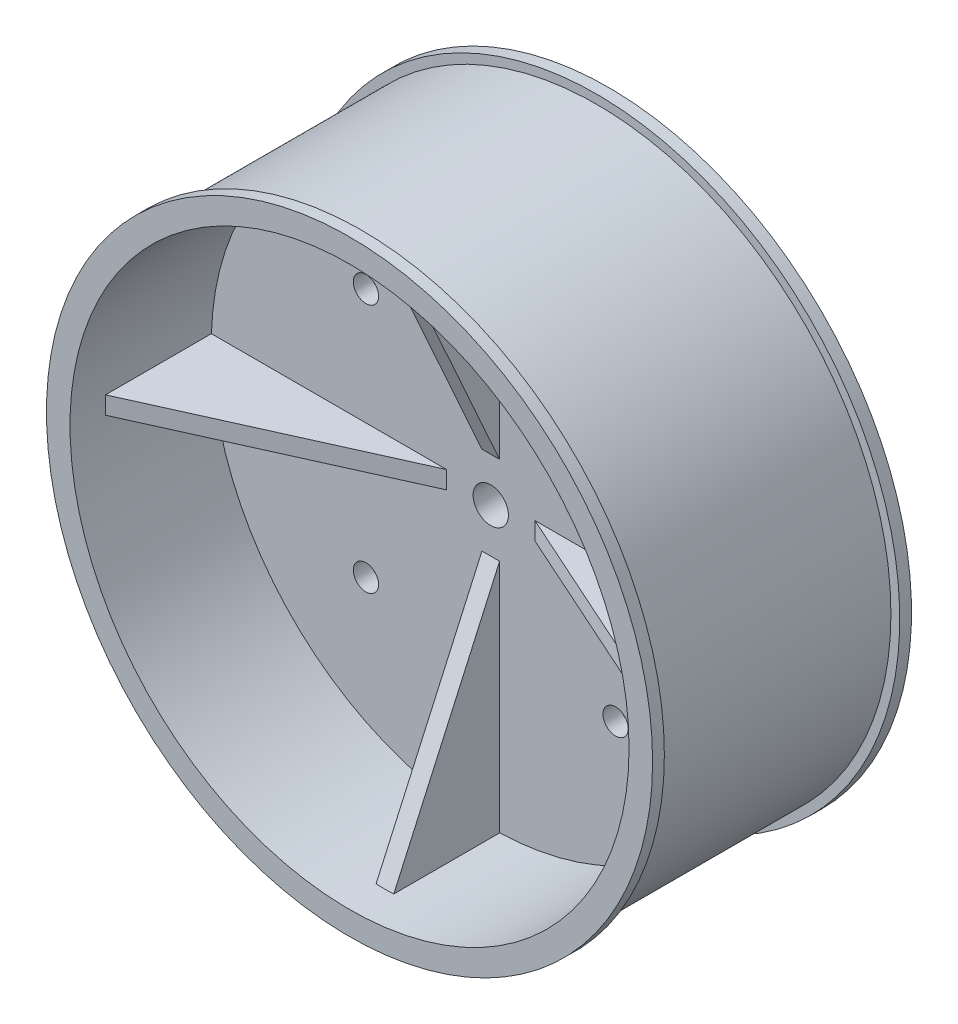
from build123d import *

# Parameters (mm, degrees)
SKETCH1_R               = 50
SKETCH1_R_2             = 47.5
BOSS_EXTRUDE1_DEPTH     = 40
SKETCH2_R               = 51.5
SKETCH2_R_2             = 47.5
BOSS_EXTRUDE2_DEPTH     = 2
BOSS_EXTRUDE3_START     = 2
SKETCH3_R               = 51.5
SKETCH3_R_2             = 47.5
BOSS_EXTRUDE3_DEPTH     = 2
SKETCH4_R               = 47.5
BOSS_EXTRUDE4_DEPTH     = 3
SKETCH5_R               = 8
BOSS_EXTRUDE5_DEPTH     = 25
SKETCH6_R               = 5
BOSS_EXTRUDE6_DEPTH     = 26.25
BOSS_EXTRUDE7_DEPTH     = 1.5
BOSS_EXTRUDE8_DEPTH     = 1.5
BOSS_EXTRUDE9_DEPTH     = 1.5
BOSS_EXTRUDE10_DEPTH    = 1.5
CUT_EXTRUDE1_DEPTH      = 91.222294917
CUT_EXTRUDE1_DEPTH_BACK = 91.222294917
SKETCH12_R              = 3
SKETCH13_R              = 4
CUT_EXTRUDE2_DEPTH      = 20
SKETCH14_R              = 1.5
CUT_EXTRUDE3_DEPTH      = 20
SKETCH15_R              = 2.15
CUT_EXTRUDE4_DEPTH      = 79.48606568


with BuildPart() as part:
    # Sketch1 → Boss-Extrude1 (new body)
    with BuildSketch(Plane.XY):
        Circle(SKETCH1_R)
        Circle(SKETCH1_R_2, mode=Mode.SUBTRACT)
    extrude(amount=BOSS_EXTRUDE1_DEPTH)

    # Sketch2 → Boss-Extrude2 (add)
    with BuildSketch(Plane.XY.offset(40)):
        Circle(SKETCH2_R)
        Circle(SKETCH2_R_2, mode=Mode.SUBTRACT)
    extrude(amount=BOSS_EXTRUDE2_DEPTH)

    # Sketch3 → Boss-Extrude3 (add)
    with BuildSketch(Plane(origin=(0, 0, 0), x_dir=(-1, 0, 0), z_dir=(0, 0, -1)).offset(BOSS_EXTRUDE3_START)):
        Circle(SKETCH3_R)
        Circle(SKETCH3_R_2, mode=Mode.SUBTRACT)
    extrude(amount=-BOSS_EXTRUDE3_DEPTH)

    # Sketch4 → Boss-Extrude4 (add)
    with BuildSketch(Plane(origin=(0, 0, 15), x_dir=(-1, 0, 0), z_dir=(0, 0, -1))):
        Circle(SKETCH4_R)
    extrude(amount=-BOSS_EXTRUDE4_DEPTH)

    # Sketch5 → Boss-Extrude5 (add)
    with BuildSketch(Plane(origin=(0, 0, 15), x_dir=(-1, 0, 0), z_dir=(0, 0, -1))):
        Circle(SKETCH5_R)
    extrude(amount=BOSS_EXTRUDE5_DEPTH)

    # Sketch6 → Boss-Extrude6 (add)
    with BuildSketch(Plane(origin=(0, 0, 15), x_dir=(-1, 0, 0), z_dir=(0, 0, -1))):
        Circle(SKETCH6_R)
    extrude(amount=BOSS_EXTRUDE6_DEPTH)

    # Sketch7 → Boss-Extrude7 (add, symmetric)
    with BuildSketch(Plane(origin=(0, 0, 0), x_dir=(1, 0, 0), z_dir=(0, 1, 0))):
        Polygon((-47.5, -15), (-5, -15), (-47.5, -4), align=None)
        Polygon((47.5, -15), (47.5, -4), (5, -15), align=None)
    extrude(amount=BOSS_EXTRUDE7_DEPTH, both=True)

    # Sketch8 → Boss-Extrude8 (add, symmetric)
    with BuildSketch(Plane(origin=(0, 0, 0), x_dir=(0, 0, -1), z_dir=(1, 0, 0))):
        Polygon((-15, -49), (-4, -49), (-15, -5), align=None)
        Polygon((-15, 5), (-15, 49), (-4, 49), align=None)
    extrude(amount=BOSS_EXTRUDE8_DEPTH, both=True)

    # Sketch10 → Boss-Extrude9 (add, symmetric)
    with BuildSketch(Plane(origin=(0, 0, 0), x_dir=(1, 0, 0), z_dir=(0, 1, 0))):
        Polygon((-47.5, -18), (-47.5, -36), (-7.5, -18), align=None)
        Polygon((7.5, -18), (47.5, -18), (47.5, -36), align=None)
    extrude(amount=BOSS_EXTRUDE9_DEPTH, both=True)

    # Sketch11 → Boss-Extrude10 (add, symmetric)
    with BuildSketch(Plane(origin=(0, 0, 0), x_dir=(0, 0, -1), z_dir=(1, 0, 0))):
        Polygon((-18, 47.5), (-36, 47.5), (-18, 7.5), align=None)
        Polygon((-18, -7.5), (-18, -47.5), (-36, -47.5), align=None)
    extrude(amount=BOSS_EXTRUDE10_DEPTH, both=True)

    # Sketch12 → Cut-Extrude1 (cut, two sides: drawn at the far end of the back side and taken through both)
    with BuildSketch(Plane(origin=(0, 0, -11.25), x_dir=(-1, 0, 0), z_dir=(0, 0, -1)).offset(-CUT_EXTRUDE1_DEPTH_BACK)):
        Circle(SKETCH12_R)
    extrude(amount=CUT_EXTRUDE1_DEPTH + CUT_EXTRUDE1_DEPTH_BACK, mode=Mode.SUBTRACT)

    # Sketch13 → Cut-Extrude2 (cut)
    with BuildSketch(Plane(origin=(0, 0, -11.25), x_dir=(-1, 0, 0), z_dir=(0, 0, -1))):
        Circle(SKETCH13_R)
    extrude(amount=-CUT_EXTRUDE2_DEPTH, mode=Mode.SUBTRACT)

    # Sketch14 → Cut-Extrude3 (cut)
    with BuildSketch(Plane(origin=(0, 0, 0), x_dir=(1, 0, 0), z_dir=(0, 1, 0))):
        with Locations((0, 3.5)):
            Circle(SKETCH14_R)
    extrude(amount=CUT_EXTRUDE3_DEPTH, mode=Mode.SUBTRACT)

    # Sketch15 → Cut-Extrude4 (cut, through all)
    with BuildSketch(Plane.XY.offset(18)):
        with Locations((21.213203436, 21.213203436)):
            Circle(SKETCH15_R)
        with Locations((21.213203436, -21.213203436)):
            Circle(SKETCH15_R)
        with Locations((-21.213203436, -21.213203436)):
            Circle(SKETCH15_R)
        with Locations((-21.213203436, 21.213203436)):
            Circle(SKETCH15_R)
    extrude(amount=-CUT_EXTRUDE4_DEPTH, mode=Mode.SUBTRACT)


solid = part.part
